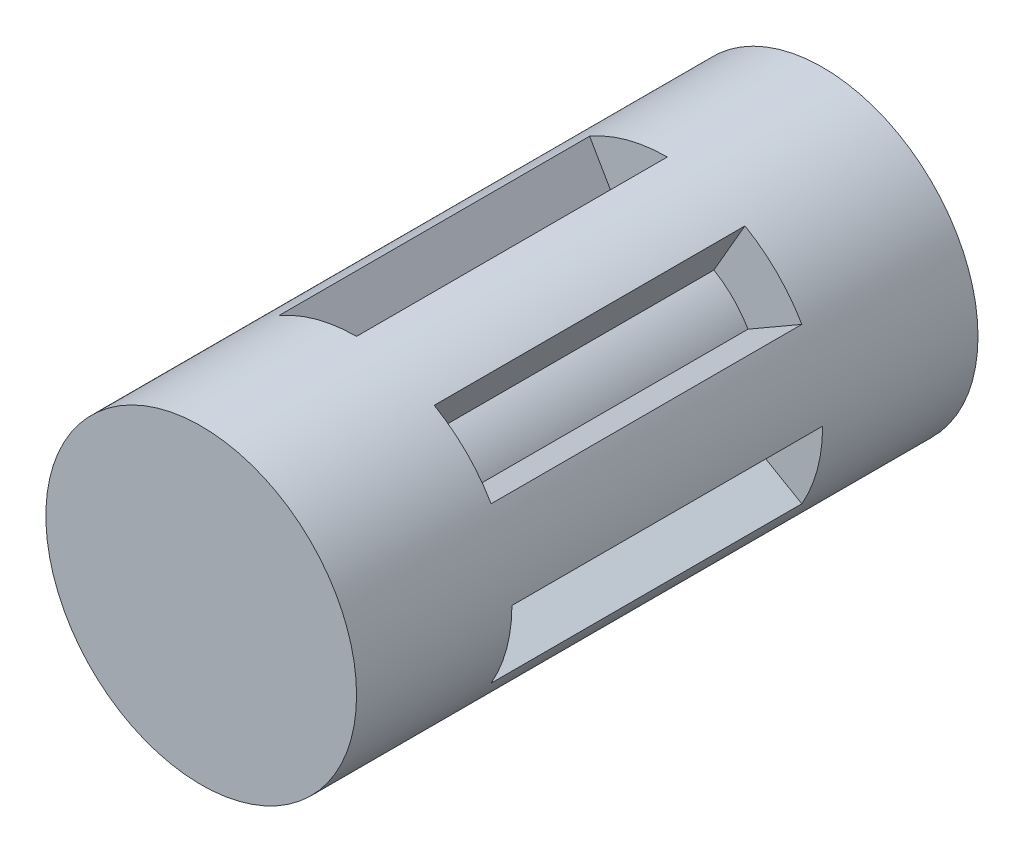
from build123d import *

# Parameters (mm, degrees)
SKETCH_1_R               = 2.5
EXTRUDE_1_DEPTH          = 5
CUT_EXTRUDE_1_DEPTH      = 2.5
PATTERN_CIRCULAR_1_COUNT = 6
MIRROR_1_COPY_1_DEPTH    = 2.5
MIRROR_1_COPY_2_DEPTH    = 2.5
MIRROR_1_COPY_3_DEPTH    = 2.5
MIRROR_1_COPY_4_DEPTH    = 2.5
MIRROR_1_COPY_5_DEPTH    = 2.5


with BuildPart() as part:
    # 草图1 → 凸台-拉伸1 (new body)
    with BuildSketch(Plane.XY):
        Circle(SKETCH_1_R)
    extrude_1 = extrude(amount=EXTRUDE_1_DEPTH)

    # 草图2 → 切除-拉伸1 (cut)
    with BuildSketch(Plane(origin=(0, 0, 0), x_dir=(-1, 0, 0), z_dir=(0, 0, -1))):
        with BuildLine():
            Line((0, 2.5), (0, 1.5))
            ThreePointArc((0, 1.5), (0.388228568, 1.448888739), (0.75, 1.299038106))
            Line((0.75, 1.299038106), (1.25, 2.165063509))
            ThreePointArc((1.25, 2.165063509), (0.647047613, 2.414814566), (0, 2.5))
        make_face()
    cut_extrude_1 = extrude(amount=-CUT_EXTRUDE_1_DEPTH, mode=Mode.SUBTRACT)

    # 阵列(圆周)1: 切除-拉伸1 ×6 about axis
    pattern_circular_1_axis = Axis((0, 0, 5), (0, 0, 1))
    for i in range(1, PATTERN_CIRCULAR_1_COUNT):
        add(cut_extrude_1.rotate(pattern_circular_1_axis, i * 360 / PATTERN_CIRCULAR_1_COUNT), mode=Mode.SUBTRACT)

    # 镜向1: 凸台-拉伸1, 切除-拉伸1 across plane
    add(extrude_1.mirror(Plane.XY))
    add(cut_extrude_1.mirror(Plane.XY), mode=Mode.SUBTRACT)

    # 镜向1 copy 1 sketch → 镜向1 copy 1 (cut)
    with BuildSketch(Plane(origin=(0, 0, 0), x_dir=(-0.5000000000000001, -0.8660254037844386, 0), z_dir=(0, 0, 1))):
        with BuildLine():
            Line((0, -2.5), (0, -1.5))
            ThreePointArc((0, -1.5), (0.388228568, -1.448888739), (0.75, -1.299038106))
            Line((0.75, -1.299038106), (1.25, -2.165063509))
            ThreePointArc((1.25, -2.165063509), (0.647047613, -2.414814566), (0, -2.5))
        make_face()
    extrude(amount=-MIRROR_1_COPY_1_DEPTH, mode=Mode.SUBTRACT)

    # 镜向1 copy 2 sketch → 镜向1 copy 2 (cut)
    with BuildSketch(Plane(origin=(0, 0, 0), x_dir=(0.4999999999999998, -0.8660254037844387, 0), z_dir=(0, 0, 1))):
        with BuildLine():
            Line((0, -2.5), (0, -1.5))
            ThreePointArc((0, -1.5), (0.388228568, -1.448888739), (0.75, -1.299038106))
            Line((0.75, -1.299038106), (1.25, -2.165063509))
            ThreePointArc((1.25, -2.165063509), (0.647047613, -2.414814566), (0, -2.5))
        make_face()
    extrude(amount=-MIRROR_1_COPY_2_DEPTH, mode=Mode.SUBTRACT)

    # 镜向1 copy 3 sketch → 镜向1 copy 3 (cut)
    with BuildSketch(Plane.XY):
        with BuildLine():
            Line((0, -2.5), (0, -1.5))
            ThreePointArc((0, -1.5), (0.388228568, -1.448888739), (0.75, -1.299038106))
            Line((0.75, -1.299038106), (1.25, -2.165063509))
            ThreePointArc((1.25, -2.165063509), (0.647047613, -2.414814566), (0, -2.5))
        make_face()
    extrude(amount=-MIRROR_1_COPY_3_DEPTH, mode=Mode.SUBTRACT)

    # 镜向1 copy 4 sketch → 镜向1 copy 4 (cut)
    with BuildSketch(Plane(origin=(0, 0, 0), x_dir=(0.5000000000000004, 0.8660254037844384, 0), z_dir=(0, 0, 1))):
        with BuildLine():
            Line((0, -2.5), (0, -1.5))
            ThreePointArc((0, -1.5), (0.388228568, -1.448888739), (0.75, -1.299038106))
            Line((0.75, -1.299038106), (1.25, -2.165063509))
            ThreePointArc((1.25, -2.165063509), (0.647047613, -2.414814566), (0, -2.5))
        make_face()
    extrude(amount=-MIRROR_1_COPY_4_DEPTH, mode=Mode.SUBTRACT)

    # 镜向1 copy 5 sketch → 镜向1 copy 5 (cut)
    with BuildSketch(Plane(origin=(0, 0, 0), x_dir=(-0.5000000000000001, 0.8660254037844386, 0), z_dir=(0, 0, 1))):
        with BuildLine():
            Line((0, -2.5), (0, -1.5))
            ThreePointArc((0, -1.5), (0.388228568, -1.448888739), (0.75, -1.299038106))
            Line((0.75, -1.299038106), (1.25, -2.165063509))
            ThreePointArc((1.25, -2.165063509), (0.647047613, -2.414814566), (0, -2.5))
        make_face()
    extrude(amount=-MIRROR_1_COPY_5_DEPTH, mode=Mode.SUBTRACT)


solid = part.part
